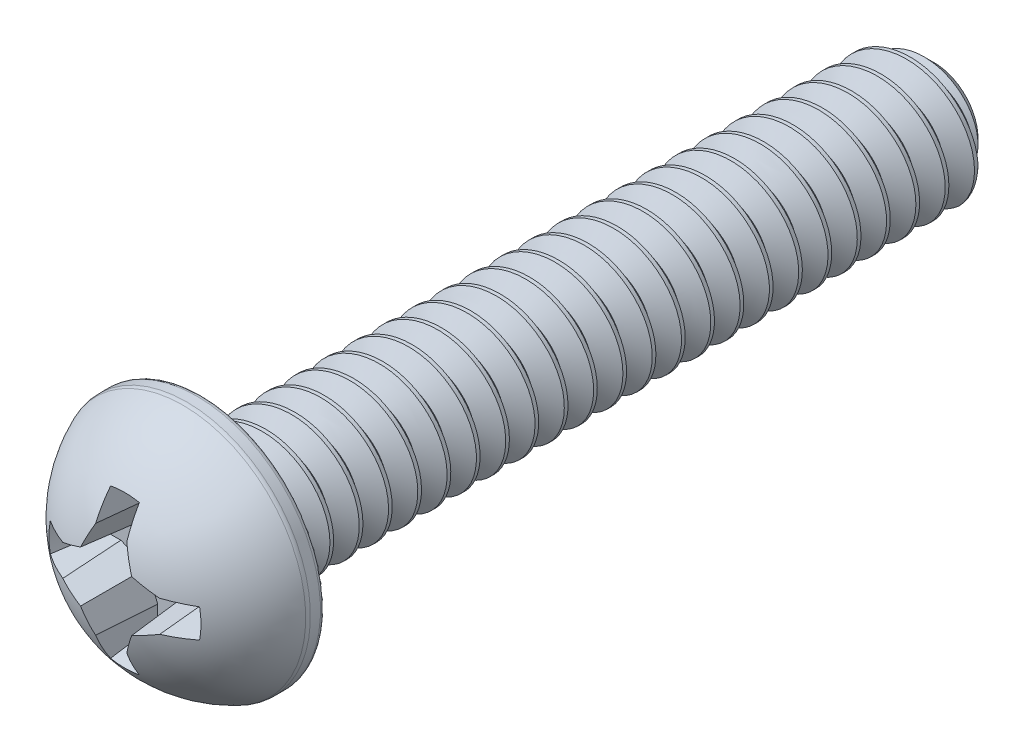
from build123d import *

# Parameters (mm, degrees)
SKETCH1_R          = 2.6796999999999995
EXTRUDE3_DEPTH     = 2.1844
CHAMFER1_SIZE      = 0.47625000000000006
CUT_SWEEP1_PITCH   = 0.6350000000000027
CUT_SWEEP1_TO      = 15.875
SKETCH26_R         = 0.5461
EXTRUDE8_DEPTH     = 2.132268765
CUT_EXTRUDE3_DEPTH = 1.4562666666666668
CIRPATTERN1_COUNT  = 4
DRAFT1_ANGLE       = 15.000000000000034
DRAFT2_ANGLE       = 5.000000000000011


with BuildPart() as part:
    # Sketch1 → Extrude3 (new body)
    with BuildSketch(Plane.XY):
        Circle(SKETCH1_R)
    extrude(amount=EXTRUDE3_DEPTH)

    # Sketch11 → Cut-Revolve3 (revolve, cut)
    with BuildSketch(Plane(origin=(0, 0, 0), x_dir=(0, 0, -1), z_dir=(1, 0, 0))):
        with BuildLine():
            Line((-2.4383999999999992, 3.1064199999999995), (-1.7e-16, 3.1064199999999995))
            Line((-1.7e-16, 3.1064199999999995), (-1e-16, 2.5704799999999994))
            ThreePointArc((-1e-16, 2.5704799999999994), (-0.03198979735880561, 2.647710202641194), (-0.1092200000000001, 2.679699999999999))
            Line((-0.1092200000000001, 2.679699999999999), (-0.3276600000000001, 2.679699999999999))
            ThreePointArc((-0.3276600000000001, 2.679699999999999), (-0.3706527055412052, 2.675427366492299), (-0.4119635572618461, 2.6627766093228997))
            ThreePointArc((-0.4119635572618461, 2.6627766093228997), (-1.7007743208814694, 1.599367860648657), (-2.1843999999999997, 1.1e-16))
            Line((-2.1843999999999997, 1.1e-16), (-2.4383999999999992, -3e-16))
            Line((-2.4383999999999992, -3e-16), (-2.4383999999999992, 3.1064199999999995))
        make_face()
    revolve(axis=Axis((0, 0, 0), (0, -1.2e-16, 1)), mode=Mode.SUBTRACT)



with BuildPart() as body_2:
    # Sketch4 → Revolve1 (revolve)
    with BuildSketch(Plane(origin=(0, 0, 0), x_dir=(0, 0, -1), z_dir=(1, 0, 0))):
        Polygon((0, 0), (15.875, 0), (15.875, 1.4224), (-1e-17, 1.4223999999999992), align=None)
    revolve(axis=Axis((0, 0, 0), (0, 0, -1)))

    # Chamfer1
    chamfer1_edges = [body_2.edges().sort_by_distance(p)[0] for p in [
        (1.7e-16, -1.4224, -15.875),
    ]]
    chamfer(chamfer1_edges, length=CHAMFER1_SIZE)

    # Cut-Sweep1: arcs per turn and ends read off the stored shape
    # Cut-Sweep1: the profile of Sketch14 profile screwed along a right-hand helix through 28 turns, 6 arcs to a turn; built about Z, then put on its axis
    cut_sweep1_z = Axis((0, 0, 0), (0, 0, 1))
    cut_sweep1_corners = [(1.4227, -4.97e-07, -0.158583743), (1.4227, -4.97e-07, -0.714541328), (0.992811128, -3.47e-07, -0.476250035), (0.992811128, -3.47e-07, -0.396875035)]
    with BuildLine(mode=Mode.PRIVATE) as cut_sweep1_profile:
        Line(cut_sweep1_corners[0], cut_sweep1_corners[1])
        Line(cut_sweep1_corners[1], cut_sweep1_corners[2])
        Line(cut_sweep1_corners[2], cut_sweep1_corners[3])
        Line(cut_sweep1_corners[3], cut_sweep1_corners[0])
    cut_sweep1_cap = Face(cut_sweep1_profile.wire())
    cut_sweep1_turn_angles = [0, 30, 60, 90, 120, 150, 180, 210, 240, 270, 300, 330, 360]
    cut_sweep1_turn_weights = [1, 0.8660254037844387, 1, 0.8660254037844387, 1, 0.8660254037844387, 1, 0.8660254037844387, 1, 0.8660254037844387, 1, 0.8660254037844387, 1]
    cut_sweep1_turn_rails = [Edge.make_bspline([Vector(p[0], p[1], 0).rotate(cut_sweep1_z, cut_sweep1_turn_angles[k]) / cut_sweep1_turn_weights[k] + Vector(0, 0, p[2] + CUT_SWEEP1_PITCH * cut_sweep1_turn_angles[k] / 360) for k in range(13)], [0, 0, 0, 1, 1, 2, 2, 3, 3, 4, 4, 5, 5, 6, 6, 6], 2, cut_sweep1_turn_weights) for p in cut_sweep1_corners]
    cut_sweep1_turn_sides = [Face.make_surface_from_curves(cut_sweep1_turn_rails[p[0]], cut_sweep1_turn_rails[p[1]]) for p in [(0, 1), (1, 2), (2, 3), (3, 0)]]
    cut_sweep1 = Plane(origin=(0, 0, -15.875), x_dir=(1, -3.49e-15, 0), z_dir=(0, 0, 1)) * split(Solid(Shell([*[p.moved(Location((0, 0, CUT_SWEEP1_PITCH * i))) for i in range(28) for p in cut_sweep1_turn_sides], cut_sweep1_cap, cut_sweep1_cap.rotate(cut_sweep1_z, 10080).moved(Location((0, 0, CUT_SWEEP1_PITCH * 10080 / 360)))])), bisect_by=Plane.XY.offset(CUT_SWEEP1_TO), keep=Keep.BOTTOM, mode=Mode.PRIVATE)
    add(cut_sweep1, mode=Mode.SUBTRACT)


with BuildPart() as part_1:
    add(part.part)

    add(body_2.part)  # Extrude8 merges body 2
    # Sketch26 → Extrude8 (add)
    with BuildSketch(Plane.XY):
        Circle(SKETCH26_R)
    extrude(amount=EXTRUDE8_DEPTH)

    # Sketch12 → Cut-Extrude3 (cut)
    with BuildSketch(Plane.XY.offset(2.1843999999999997)):
        with BuildLine():
            Line((1.7503727103296218, 0.35729333333333346), (1.0538330218314778, 0.3572933333333336))
            Line((1.0538330218314778, 0.3572933333333336), (0.5613050847288744, 0.5613050847288744))
            Line((0.5613050847288744, 0.5613050847288744), (0.35729333333333335, 1.0538330218314778))
            Line((0.35729333333333335, 1.0538330218314778), (0.35729333333333335, 1.7503727103296218))
            ThreePointArc((0.35729333333333335, 1.7503727103296218), (0.17955591032357107, 1.7774202728052206), (0, 1.7864666666666666))
            Line((0, 1.7864666666666666), (0, 3.3e-16))
            Line((0, 3.3e-16), (1.7864666666666662, 4.3e-16))
            ThreePointArc((1.7864666666666662, 4.3e-16), (1.7774202728052202, 0.17955591032357113), (1.7503727103296218, 0.35729333333333346))
        make_face()
    cut_extrude3 = extrude(amount=-CUT_EXTRUDE3_DEPTH, mode=Mode.SUBTRACT)

    # CirPattern1: Cut-Extrude3 ×4 about axis
    cirpattern1_axis = Axis((-2e-17, -2e-17, 0), (0, 0, 1))
    for i in range(1, CIRPATTERN1_COUNT):
        add(cut_extrude3.rotate(cirpattern1_axis, i * 360 / CIRPATTERN1_COUNT), mode=Mode.SUBTRACT)

    # Draft1
    draft1_faces = [part_1.faces().sort_by_distance(p)[0] for p in [
        (-1.7864666666666666, 3.99e-15, 1.1466272083675035),
        (-4.14e-15, -1.7864666666666666, 1.1466272083675042),
        (1.7864666666666666, -3.98e-15, 1.1466272083675038),
        (-1.3e-16, 1.786466666666666, 1.1466272083675029),
    ]]
    draft(draft1_faces, Plane.XY.offset(2.1843999999999997), DRAFT1_ANGLE)

    # Draft2
    draft2_faces = [part_1.faces().sort_by_distance(p)[0] for p in [
        (0.35729333333333335, 1.2684050568817975, 1.3407547378194864),
        (0.46076067394885706, 0.8040407648548038, 1.3776063614735639),
        (0.8040407648548039, 0.46076067394885706, 1.377606361473564),
        (1.2684050465917887, 0.3572933333333335, 1.3407546843529614),
        (1.268405046591789, -0.3572933333333337, 1.3407546843529614),
        (0.8040407648548037, -0.4607606739488573, 1.3776063614735643),
        (0.46076067394885695, -0.8040407648548039, 1.3776063614735643),
        (0.35729333333333324, -1.2684050465917887, 1.340754684352962),
        (-0.3572933333333336, -1.268405046591789, 1.3407546843529616),
        (-0.4607606739488572, -0.8040407648548038, 1.3776063614735643),
        (-0.804040764854804, -0.4607606739488571, 1.3776063614735643),
        (-1.2684050465917887, -0.35729333333333346, 1.3407546843529619),
        (-1.268405046591789, 0.3572933333333335, 1.3407546843529614),
        (-0.8040407648548038, 0.46076067394885717, 1.377606361473564),
        (-0.46076067394885706, 0.8040407648548039, 1.3776063614735639),
        (-0.35729333333333346, 1.268405046591787, 1.3407546843529592),
    ]]
    draft(draft2_faces, Plane.XY.offset(2.1843999999999997), DRAFT2_ANGLE)


solid = part_1.part
